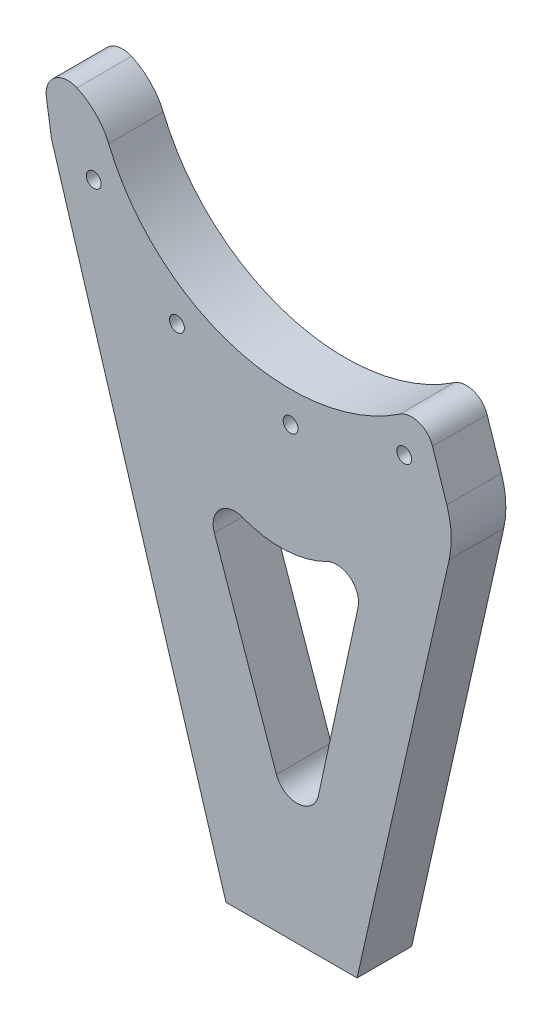
from build123d import *

# Parameters (mm, degrees)
SKETCH1_R           = 1.7
BOSS_EXTRUDE1_DEPTH = 12.5
FILLET4_R           = 5
FILLET5_R           = 5
FILLET6_R           = 5
FILLET7_R           = 20
SKETCH2_R           = 1.745
CUT_EXTRUDE1_DEPTH  = 10
CUT_EXTRUDE2_DEPTH  = 35
FILLET8_R           = 5
FILLET9_R           = 5


with BuildPart() as part:
    # Sketch1 → Boss-Extrude1 (new body)
    with BuildSketch(Plane.XY):
        with BuildLine():
            ThreePointArc((-41.615847066, -17.120784823), (-47.779287866, -10.266909246), (-56.849444808, -8.625))
            Line((-56.849444808, -8.625), (-54.713862361, -22.701136402))
            Line((-54.713862361, -22.701136402), (-14.786422414, -154.047675233))
            Line((-14.786422414, -154.047675233), (15.213577586, -154.047675233))
            Line((15.213577586, -154.047675233), (37.488789117, -55.269230384))
            Line((37.488789117, -55.269230384), (30.258636425, -33.307880775))
            ThreePointArc((30.258636425, -33.307880775), (-9.886965016, -43.90043192), (-41.615847066, -17.120784823))
        make_face()
        with Locations((0, -52)):
            Circle(SKETCH1_R, mode=Mode.SUBTRACT)
        with Locations((-45.033320997, -26)):
            Circle(SKETCH1_R, mode=Mode.SUBTRACT)
        with Locations((-26, -45.033320997)):
            Circle(SKETCH1_R, mode=Mode.SUBTRACT)
        with Locations((26, -45.033320997)):
            Circle(SKETCH1_R, mode=Mode.SUBTRACT)
    extrude(amount=BOSS_EXTRUDE1_DEPTH)

    # Fillet4
    fillet4_edges = [part.edges().sort_by_distance(p)[0] for p in [
        (-56.849444808, -8.625, 6.25),
    ]]
    fillet(fillet4_edges, radius=FILLET4_R)

    # Fillet5
    fillet5_edges = [part.edges().sort_by_distance(p)[0] for p in [
        (-54.713862361, -22.701136402, 6.25),
    ]]
    fillet(fillet5_edges, radius=FILLET5_R)

    # Fillet6
    fillet6_edges = [part.edges().sort_by_distance(p)[0] for p in [
        (30.258636425, -33.307880775, 6.25),
    ]]
    fillet(fillet6_edges, radius=FILLET6_R)

    # Fillet7
    fillet7_edges = [part.edges().sort_by_distance(p)[0] for p in [
        (37.488789117, -55.269230384, 6.25),
    ]]
    fillet(fillet7_edges, radius=FILLET7_R)

    # Sketch2 → Cut-Extrude1 (cut)
    with BuildSketch(Plane(origin=(0, -154.047675233, 0), x_dir=(-1, 0, 0), z_dir=(0, -1, 0))):
        with Locations((-0.213577586, -6.25)):
            Circle(SKETCH2_R)
    extrude(amount=-CUT_EXTRUDE1_DEPTH, mode=Mode.SUBTRACT)

    # Sketch3 → Cut-Extrude2 (cut)
    with BuildSketch(Plane(origin=(0, 0, 0), x_dir=(-1, 0, 0), z_dir=(0, 0, -1))):
        with BuildLine():
            Line((-19.010121999, -64.01448337), (-2.601927454, -139.726581059))
            Line((-2.601927454, -139.726581059), (24.588794936, -61.670455578))
            ThreePointArc((24.588794936, -61.670455578), (3.57566323, -77.468147247), (-19.010121999, -64.01448337))
        make_face()
    extrude(amount=-CUT_EXTRUDE2_DEPTH, mode=Mode.SUBTRACT)

    # Fillet8
    fillet8_edges = [part.edges().sort_by_distance(p)[0] for p in [
        (2.601927454, -139.726581059, 6.25),
    ]]
    fillet(fillet8_edges, radius=FILLET8_R)

    # Fillet9
    fillet9_edges = [part.edges().sort_by_distance(p)[0] for p in [
        (19.010121999, -64.01448337, 6.25),
    ]]
    fillet(fillet9_edges, radius=FILLET9_R)
    fillet9_2_edges = [part.edges().sort_by_distance(p)[0] for p in [
        (-24.588794936, -61.670455578, 6.25),
    ]]
    fillet(fillet9_2_edges, radius=FILLET9_R)


solid = part.part
